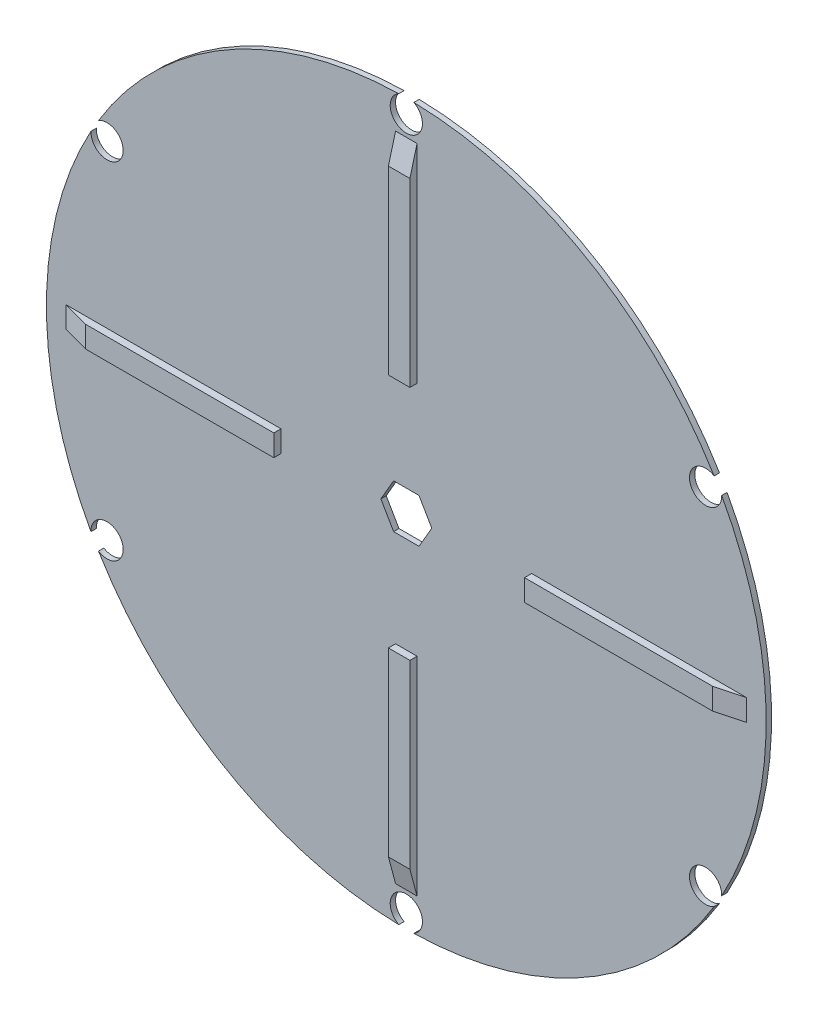
from build123d import *
from OCP.BRepFilletAPI import BRepFilletAPI_MakeChamfer

# Parameters (mm, degrees)
SKETCH1_R           = 100.5
BOSS_EXTRUDE1_DEPTH = 1.5
SKETCH8_W           = 1.221153846
SKETCH8_H           = 0.325641026
CUT_EXTRUDE6_DEPTH  = 0.2
CUT_EXTRUDE7_DEPTH  = 10
BOSS_EXTRUDE2_DEPTH = 2
CHAMFER1_SIZE       = 2
CHAMFER1_SIZE_2     = 7.464101615
SKETCH12_R          = 4.5
CUT_EXTRUDE8_DEPTH  = 10


with BuildPart() as part:
    # Sketch1 → Boss-Extrude1 (new body)
    with BuildSketch(Plane.XY):
        Circle(SKETCH1_R)
    extrude(amount=BOSS_EXTRUDE1_DEPTH)

    # Sketch8 → Cut-Extrude6 (cut)
    # profile 1 of 12: a face of its own
    with BuildSketch(Plane(origin=(0, 0, 0), x_dir=(-1, 0, 0), z_dir=(0, 0, -1))):
        with BuildLine():
            add(Edge.make_bspline(
                [(-21.303796635, -42.5044388), (-21.303499075, -42.453550456), (-21.302921062, -42.354699113), (-21.296490852, -42.210658759), (-21.285808934, -42.075530497), (-21.271170032, -41.949307858), (-21.253355578, -41.831958258), (-21.229574387, -41.723795299), (-21.202529916, -41.62431837), (-21.171185911, -41.533203084), (-21.135818417, -41.449221882), (-21.09732448, -41.370821878), (-21.054176417, -41.298121696), (-21.008840217, -41.229960986), (-20.959480695, -41.167455492), (-20.907502507, -41.109722505), (-20.850876948, -41.058096324), (-20.791528933, -41.011064321), (-20.72892114, -40.969835158), (-20.66483815, -40.933519745), (-20.598838876, -40.902495579), (-20.530743124, -40.878102113), (-20.461162947, -40.857953702), (-20.389855107, -40.844175156), (-20.31670187, -40.835505675), (-20.267324783, -40.834676848), (-20.242283213, -40.834256508)],
                knots=[0, 0, 0, 0, 1.646270934, 3.197905019, 4.663502075, 6.030701355, 7.308322542, 8.50163776, 9.611534131, 10.641858119, 11.616356847, 12.558055219, 13.465016945, 14.349605745, 15.204443733, 16.039544428, 16.859896111, 17.680448484, 18.487036065, 19.28249412, 20.06191084, 20.843045899, 21.620316918, 22.403196591, 23.190181807, 24, 24, 24, 24], degree=3))
            add(Edge.make_bspline(
                [(-20.242283213, -40.834256508), (-20.217032458, -40.834699027), (-20.16681665, -40.835579056), (-20.092575738, -40.844037204), (-20.020049955, -40.858071722), (-19.949548501, -40.877957178), (-19.880492263, -40.902627542), (-19.813421379, -40.933549427), (-19.747919241, -40.969543828), (-19.685026766, -41.011838345), (-19.624053507, -41.058993695), (-19.566497141, -41.112299831), (-19.512352427, -41.171218505), (-19.460939829, -41.235119338), (-19.413717966, -41.305227951), (-19.368747781, -41.380324965), (-19.328496005, -41.461723678), (-19.28972955, -41.548065959), (-19.256267783, -41.64174085), (-19.226090547, -41.742220311), (-19.201707482, -41.850691181), (-19.181397214, -41.966584346), (-19.165662915, -42.09032542), (-19.154203304, -42.221649149), (-19.148149863, -42.360641932), (-19.147009855, -42.455672267), (-19.14642484, -42.5044388)],
                knots=[0, 0, 0, 0, 0.810914788, 1.612654377, 2.396697861, 3.181598691, 3.963628158, 4.749916497, 5.551656086, 6.361998678, 7.18212741, 8.025565596, 8.878627764, 9.750805457, 10.657531673, 11.591944965, 12.560506719, 13.57287815, 14.630710178, 15.753379473, 16.941251878, 18.199788006, 19.531962791, 20.947069417, 22.433333509, 24, 24, 24, 24], degree=3))
            add(Edge.make_bspline(
                [(-19.14642484, -42.5044388), (-19.14701592, -42.552992631), (-19.148167616, -42.64759779), (-19.154135443, -42.785965175), (-19.165890773, -42.916591971), (-19.180595548, -43.039791462), (-19.200961778, -43.155050874), (-19.226003608, -43.262769052), (-19.253807829, -43.363411174), (-19.288129392, -43.456152753), (-19.325694822, -43.54228753), (-19.366566322, -43.622721301), (-19.41035395, -43.698165009), (-19.458059454, -43.768014779), (-19.508907908, -43.832765418), (-19.563987616, -43.891273976), (-19.621745933, -43.944950228), (-19.682898624, -43.992712776), (-19.74677196, -44.034518277), (-19.812049122, -44.071905127), (-19.879888334, -44.102051929), (-19.948752227, -44.127937288), (-20.019625817, -44.147713412), (-20.092420757, -44.161387553), (-20.166766771, -44.170977729), (-20.217023905, -44.171709322), (-20.242283213, -44.172077021)],
                knots=[0, 0, 0, 0, 1.561518951, 3.042555995, 4.452378317, 5.7783523, 7.031515105, 8.214008947, 9.334062868, 10.386615937, 11.391082383, 12.354592575, 13.286541444, 14.194233754, 15.072674879, 15.931287219, 16.775624067, 17.606195743, 18.42308326, 19.229000347, 20.022332153, 20.807536673, 21.593273796, 22.3848459, 23.188221202, 24, 24, 24, 24], degree=3))
            add(Edge.make_bspline(
                [(-20.242283213, -44.172077021), (-20.267324088, -44.17165397), (-20.316699806, -44.170819796), (-20.389863077, -44.162189483), (-20.460876437, -44.148314276), (-20.530090306, -44.128886357), (-20.597859788, -44.105105755), (-20.663261419, -44.074123485), (-20.72702239, -44.038441865), (-20.788972587, -43.997806019), (-20.847947904, -43.951249921), (-20.904280211, -43.899756602), (-20.956554335, -43.842041078), (-21.005208122, -43.779014677), (-21.051448902, -43.711257236), (-21.093984262, -43.63784364), (-21.133327822, -43.559064986), (-21.169290132, -43.47441231), (-21.201174991, -43.38265034), (-21.229339697, -43.282729299), (-21.25157754, -43.173767258), (-21.270612078, -43.056639361), (-21.285964912, -42.930842295), (-21.296446335, -42.796307768), (-21.302924528, -42.653119614), (-21.303500628, -42.554903462), (-21.303796635, -42.5044388)],
                knots=[0, 0, 0, 0, 0.810891512, 1.598919785, 2.382837074, 3.152667961, 3.926044502, 4.706494248, 5.493654104, 6.291793342, 7.103789334, 7.925228297, 8.761435821, 9.622817696, 10.50288917, 11.416980706, 12.369136599, 13.353924996, 14.394355917, 15.514179734, 16.714354668, 17.994756427, 19.357759367, 20.818452758, 22.365282078, 24, 24, 24, 24], degree=3))
        make_face()
        with BuildLine():
            add(Edge.make_bspline(
                [(-21.018860737, -42.503166765), (-21.018752382, -42.545574513), (-21.018542085, -42.627879625), (-21.013048246, -42.747480298), (-21.005564107, -42.859031953), (-20.99591093, -42.962676233), (-20.981575398, -43.058062315), (-20.965512812, -43.145846242), (-20.945965617, -43.22556345), (-20.922837993, -43.297760964), (-20.896495384, -43.363664048), (-20.867733636, -43.424988007), (-20.836835695, -43.482457264), (-20.802256179, -43.535555608), (-20.764596086, -43.5844562), (-20.724706058, -43.630024555), (-20.681097357, -43.670661817), (-20.620768962, -43.71939975), (-20.541125017, -43.769763535), (-20.440776462, -43.813620345), (-20.337662938, -43.841181574), (-20.267675733, -43.844686552), (-20.232742949, -43.846435996)],
                knots=[0, 0, 0, 0, 1.459021318, 2.831673884, 4.118529203, 5.306027144, 6.411944654, 7.436330062, 8.375795394, 9.233974572, 10.042671642, 10.816086306, 11.563610507, 12.285937304, 12.993564865, 13.685989202, 14.367179055, 15.041617293, 16.353048772, 17.594441528, 18.799311195, 20, 20, 20, 20], degree=3))
            add(Edge.make_bspline(
                [(-20.232742949, -43.846435996), (-20.197584204, -43.84498658), (-20.127339304, -43.842090742), (-20.024710789, -43.814151887), (-19.925079044, -43.771997376), (-19.846999499, -43.722152139), (-19.787597477, -43.674682869), (-19.745037065, -43.63421101), (-19.705973635, -43.588893901), (-19.668924038, -43.53999954), (-19.634943305, -43.486593787), (-19.604043173, -43.42893345), (-19.575846137, -43.36685841), (-19.559781502, -43.323524433), (-19.551568069, -43.301368888)],
                knots=[0, 0, 0, 0, 1.353760809, 2.704726607, 4.075137775, 5.516104923, 6.260822281, 7.007110065, 7.778089737, 8.566572457, 9.372053459, 10.217411131, 11.088608312, 12, 12, 12, 12], degree=3))
            add(Edge.make_bspline(
                [(-19.551568069, -43.301368888), (-19.541996108, -43.273039053), (-19.522560923, -43.215517338), (-19.497513099, -43.126287454), (-19.477786916, -43.032667804), (-19.460040148, -42.935217877), (-19.447927019, -42.833219005), (-19.438177217, -42.726986785), (-19.432434379, -42.616441121), (-19.431722498, -42.541334236), (-19.431360737, -42.503166765)],
                knots=[0, 0, 0, 0, 0.884706709, 1.796334032, 2.740027952, 3.714592787, 4.726048262, 5.777819803, 6.87074269, 8, 8, 8, 8], degree=3))
            add(Edge.make_bspline(
                [(-19.431360737, -42.503166765), (-19.431859838, -42.465005467), (-19.432836184, -42.39035381), (-19.436568159, -42.281026604), (-19.446205259, -42.177187992), (-19.456908745, -42.078390635), (-19.47269051, -41.985181431), (-19.48970652, -41.896780083), (-19.51256762, -41.814281768), (-19.536987702, -41.736394861), (-19.564937132, -41.664004268), (-19.595703548, -41.596772476), (-19.628561858, -41.534374904), (-19.66425089, -41.47698275), (-19.702346974, -41.424338943), (-19.743855608, -41.377498989), (-19.787130289, -41.335011168), (-19.847743022, -41.286512981), (-19.927094699, -41.237063086), (-20.025833251, -41.191555575), (-20.128585906, -41.165422338), (-20.198048968, -41.161737808), (-20.232742949, -41.159897534)],
                knots=[0, 0, 0, 0, 1.31362396, 2.569729283, 3.763502607, 4.902122613, 5.988968491, 7.01645872, 7.998833611, 8.933434873, 9.825090667, 10.667526885, 11.477055099, 12.250526234, 12.991942729, 13.710640831, 14.402115721, 15.076753259, 16.378508321, 17.609869233, 18.806226677, 20, 20, 20, 20], degree=3))
            add(Edge.make_bspline(
                [(-20.232742949, -41.159897534), (-20.267858986, -41.161740346), (-20.338155033, -41.165429328), (-20.441975678, -41.191458208), (-20.541493197, -41.236827113), (-20.620635038, -41.286676765), (-20.681290045, -41.334155091), (-20.724000774, -41.375327088), (-20.764047658, -41.420363333), (-20.800939072, -41.469713642), (-20.835491493, -41.522750082), (-20.867224269, -41.57988989), (-20.895814989, -41.641422628), (-20.922198819, -41.707296108), (-20.945396991, -41.779487394), (-20.964532229, -41.859106409), (-20.98220977, -41.946611125), (-20.994724049, -42.042513822), (-21.005849028, -42.146184061), (-21.012998536, -42.2580142), (-21.018560463, -42.377815459), (-21.018758641, -42.460546124), (-21.018860737, -42.503166765)],
                knots=[0, 0, 0, 0, 1.207732386, 2.417664972, 3.655092373, 4.956220595, 5.625982001, 6.301752483, 6.994047911, 7.697131622, 8.419323945, 9.170223765, 9.943494443, 10.752040957, 11.610060368, 12.549350801, 13.567764191, 14.679664412, 15.874934091, 17.154273443, 18.533957287, 20, 20, 20, 20], degree=3))
        make_face(mode=Mode.SUBTRACT)
    # profile 2 of 12: a face of its own
    with BuildSketch(Plane(origin=(0, 0, 0), x_dir=(-1, 0, 0), z_dir=(0, 0, -1))):
        with BuildLine():
            Line((-18.45443766, -41.892589842), (-18.739373558, -41.892589842))
            add(Edge.make_bspline(
                [(-18.739373558, -41.892589842), (-18.737516498, -41.854788394), (-18.733869281, -41.780547355), (-18.716789333, -41.672303526), (-18.692350108, -41.56883953), (-18.657795718, -41.470986108), (-18.614882166, -41.377878047), (-18.563419927, -41.289885176), (-18.502465505, -41.207343169), (-18.433335111, -41.131017218), (-18.358252131, -41.060997065), (-18.277238886, -41.000531237), (-18.19210804, -40.949443064), (-18.103117871, -40.906733652), (-18.00926436, -40.874675363), (-17.911399196, -40.85088859), (-17.809092408, -40.836577191), (-17.73938753, -40.835038871), (-17.703936859, -40.834256508)],
                knots=[0, 0, 0, 0, 1.10065271, 2.161652631, 3.183658789, 4.190468796, 5.17591951, 6.163126047, 7.15150782, 8.156236427, 9.156009102, 10.134482811, 11.092018607, 12.041330605, 13.001268258, 13.972401359, 14.968799086, 16, 16, 16, 16], degree=3))
            add(Edge.make_bspline(
                [(-17.703936859, -40.834256508), (-17.669122463, -40.835071537), (-17.600713419, -40.836673038), (-17.500871449, -40.850426258), (-17.405823475, -40.871966902), (-17.315755287, -40.902188744), (-17.231385499, -40.942814617), (-17.152080309, -40.99161667), (-17.076895574, -41.048058946), (-17.009216563, -41.114510619), (-16.947069948, -41.185451354), (-16.893455759, -41.261186809), (-16.84754239, -41.33940909), (-16.809272137, -41.420714673), (-16.781099783, -41.505869105), (-16.75971098, -41.593632639), (-16.747621111, -41.684913718), (-16.74576562, -41.746696093), (-16.744822276, -41.778106669)],
                knots=[0, 0, 0, 0, 1.111607364, 2.184268762, 3.212621178, 4.221274766, 5.211760367, 6.196651075, 7.1921475, 8.207485113, 9.220403448, 10.201281604, 11.166441695, 12.114753415, 13.065576456, 14.026450734, 14.996634279, 16, 16, 16, 16], degree=3))
            add(Edge.make_bspline(
                [(-16.744822276, -41.778106669), (-16.746358307, -41.822327919), (-16.749403415, -41.909994398), (-16.775451456, -42.038822167), (-16.816133648, -42.163639054), (-16.865116965, -42.264093606), (-16.914531253, -42.345041133), (-16.959060635, -42.411687744), (-17.011189428, -42.483447704), (-17.071676351, -42.560080718), (-17.139270171, -42.642187039), (-17.214583134, -42.729717067), (-17.298152292, -42.821766459), (-17.356806789, -42.88463654), (-17.38720008, -42.917214241)],
                knots=[0, 0, 0, 0, 1.184426356, 2.348067706, 3.509069118, 4.696110526, 5.333549288, 6.050745305, 6.844228056, 7.710549037, 8.667450064, 9.695053472, 10.805634456, 12, 12, 12, 12], degree=3))
            Line((-17.38720008, -42.917214241), (-18.181586098, -43.765025739))
            Line((-18.181586098, -43.765025739), (-16.704117148, -43.765025739))
            Line((-16.704117148, -43.765025739), (-16.704117148, -44.090666765))
            Line((-16.704117148, -44.090666765), (-18.861488943, -44.090666765))
            Line((-18.861488943, -44.090666765), (-17.630158814, -42.776654345))
            add(Edge.make_bspline(
                [(-17.630158814, -42.776654345), (-17.60017966, -42.745359453), (-17.54259584, -42.685248369), (-17.461150216, -42.597488684), (-17.387999134, -42.516073029), (-17.322669071, -42.441155231), (-17.266577248, -42.371639452), (-17.216800295, -42.309777114), (-17.176917223, -42.252849863), (-17.133632542, -42.186863734), (-17.091709859, -42.106298275), (-17.055685079, -42.007842714), (-17.033718752, -41.906490135), (-17.031083652, -41.837999001), (-17.029758173, -41.803547374)],
                knots=[0, 0, 0, 0, 1.329631726, 2.553950428, 3.673215718, 4.687767853, 5.603093632, 6.413772471, 7.123043292, 7.734684054, 8.834405432, 9.900288307, 10.943827018, 12, 12, 12, 12], degree=3))
            add(Edge.make_bspline(
                [(-17.029758173, -41.803547374), (-17.030334882, -41.781883534), (-17.031471465, -41.739188265), (-17.041502377, -41.676590184), (-17.056661193, -41.616206389), (-17.078382963, -41.557851141), (-17.107054791, -41.502111157), (-17.141955643, -41.448918586), (-17.182223772, -41.397493596), (-17.228806709, -41.349275961), (-17.279980016, -41.305115153), (-17.334040514, -41.265995447), (-17.391235966, -41.233302825), (-17.451325219, -41.206502653), (-17.514140752, -41.185479271), (-17.579804057, -41.170911846), (-17.6481337, -41.161765592), (-17.694791229, -41.160528093), (-17.718565265, -41.159897534)],
                knots=[0, 0, 0, 0, 0.991446411, 1.95395049, 2.89581595, 3.838931463, 4.798493298, 5.75982156, 6.748411868, 7.785213223, 8.824556874, 9.840280684, 10.836137867, 11.835679398, 12.848801643, 13.863922112, 14.911575587, 16, 16, 16, 16], degree=3))
            add(Edge.make_bspline(
                [(-17.718565265, -41.159897534), (-17.74339452, -41.160546171), (-17.792155078, -41.161819985), (-17.863745915, -41.170730545), (-17.93204087, -41.186102843), (-17.997211739, -41.207127398), (-18.059368792, -41.23385051), (-18.118209747, -41.267135164), (-18.17360251, -41.306853047), (-18.225651214, -41.351884123), (-18.273606395, -41.402019733), (-18.315740346, -41.457908771), (-18.352555845, -41.518530783), (-18.384677078, -41.583722197), (-18.410762597, -41.654074554), (-18.430695384, -41.729338115), (-18.446467737, -41.809186083), (-18.451736895, -41.864326838), (-18.45443766, -41.892589842)],
                knots=[0, 0, 0, 0, 1.031018746, 2.02475058, 2.990194455, 3.934040569, 4.864654155, 5.795059489, 6.735614925, 7.690564532, 8.649604399, 9.611025574, 10.590972636, 11.591080095, 12.624614302, 13.701020113, 14.821632451, 16, 16, 16, 16], degree=3))
        make_face()
    # profile 3 of 12: a face of its own
    with BuildSketch(Plane(origin=(0, 0, 0), x_dir=(-1, 0, 0), z_dir=(0, 0, -1))):
        with Locations((-15.808604327, -42.869512919)):
            Rectangle(SKETCH8_W, SKETCH8_H)
    # profile 4 of 12: a face of its own
    with BuildSketch(Plane(origin=(0, 0, 0), x_dir=(-1, 0, 0), z_dir=(0, 0, -1))):
        with BuildLine():
            add(Edge.make_bspline(
                [(-14.953796635, -42.5044388), (-14.953499075, -42.453550456), (-14.952921062, -42.354699113), (-14.946490852, -42.210658759), (-14.935808934, -42.075530497), (-14.921170032, -41.949307858), (-14.903355578, -41.831958258), (-14.879574387, -41.723795299), (-14.852529916, -41.62431837), (-14.821185911, -41.533203084), (-14.785818417, -41.449221882), (-14.74732448, -41.370821878), (-14.704176417, -41.298121696), (-14.658840217, -41.229960986), (-14.609480695, -41.167455492), (-14.557502507, -41.109722505), (-14.500876948, -41.058096324), (-14.441528933, -41.011064321), (-14.37892114, -40.969835158), (-14.31483815, -40.933519745), (-14.248838876, -40.902495579), (-14.180743124, -40.878102113), (-14.111162947, -40.857953702), (-14.039855107, -40.844175156), (-13.96670187, -40.835505675), (-13.917324783, -40.834676848), (-13.892283213, -40.834256508)],
                knots=[0, 0, 0, 0, 1.646270934, 3.197905019, 4.663502075, 6.030701355, 7.308322542, 8.50163776, 9.611534131, 10.641858119, 11.616356847, 12.558055219, 13.465016945, 14.349605745, 15.204443733, 16.039544428, 16.859896111, 17.680448484, 18.487036065, 19.28249412, 20.06191084, 20.843045899, 21.620316918, 22.403196591, 23.190181807, 24, 24, 24, 24], degree=3))
            add(Edge.make_bspline(
                [(-13.892283213, -40.834256508), (-13.867032458, -40.834699027), (-13.81681665, -40.835579056), (-13.742575738, -40.844037204), (-13.670049955, -40.858071722), (-13.599548501, -40.877957178), (-13.530492263, -40.902627542), (-13.463421379, -40.933549427), (-13.397919241, -40.969543828), (-13.335026766, -41.011838345), (-13.274053507, -41.058993695), (-13.216497141, -41.112299831), (-13.162352427, -41.171218505), (-13.110939829, -41.235119338), (-13.063717966, -41.305227951), (-13.018747781, -41.380324965), (-12.978496005, -41.461723678), (-12.93972955, -41.548065959), (-12.906267783, -41.64174085), (-12.876090547, -41.742220311), (-12.851707482, -41.850691181), (-12.831397214, -41.966584346), (-12.815662915, -42.09032542), (-12.804203304, -42.221649149), (-12.798149863, -42.360641932), (-12.797009855, -42.455672267), (-12.79642484, -42.5044388)],
                knots=[0, 0, 0, 0, 0.810914788, 1.612654377, 2.396697861, 3.181598691, 3.963628158, 4.749916497, 5.551656086, 6.361998678, 7.18212741, 8.025565596, 8.878627764, 9.750805457, 10.657531673, 11.591944965, 12.560506719, 13.57287815, 14.630710178, 15.753379473, 16.941251878, 18.199788006, 19.531962791, 20.947069417, 22.433333509, 24, 24, 24, 24], degree=3))
            add(Edge.make_bspline(
                [(-12.79642484, -42.5044388), (-12.79701592, -42.552992631), (-12.798167616, -42.64759779), (-12.804135443, -42.785965175), (-12.815890773, -42.916591971), (-12.830595548, -43.039791462), (-12.850961778, -43.155050874), (-12.876003608, -43.262769052), (-12.903807829, -43.363411174), (-12.938129392, -43.456152753), (-12.975694822, -43.54228753), (-13.016566322, -43.622721301), (-13.06035395, -43.698165009), (-13.108059454, -43.768014779), (-13.158907908, -43.832765418), (-13.213987616, -43.891273976), (-13.271745933, -43.944950228), (-13.332898624, -43.992712776), (-13.39677196, -44.034518277), (-13.462049122, -44.071905127), (-13.529888334, -44.102051929), (-13.598752227, -44.127937288), (-13.669625817, -44.147713412), (-13.742420757, -44.161387553), (-13.816766771, -44.170977729), (-13.867023905, -44.171709322), (-13.892283213, -44.172077021)],
                knots=[0, 0, 0, 0, 1.561518951, 3.042555995, 4.452378317, 5.7783523, 7.031515105, 8.214008947, 9.334062868, 10.386615937, 11.391082383, 12.354592575, 13.286541444, 14.194233754, 15.072674879, 15.931287219, 16.775624067, 17.606195743, 18.42308326, 19.229000347, 20.022332153, 20.807536673, 21.593273796, 22.3848459, 23.188221202, 24, 24, 24, 24], degree=3))
            add(Edge.make_bspline(
                [(-13.892283213, -44.172077021), (-13.917324088, -44.17165397), (-13.966699806, -44.170819796), (-14.039863077, -44.162189483), (-14.110876437, -44.148314276), (-14.180090306, -44.128886357), (-14.247859788, -44.105105755), (-14.313261419, -44.074123485), (-14.37702239, -44.038441865), (-14.438972587, -43.997806019), (-14.497947904, -43.951249921), (-14.554280211, -43.899756602), (-14.606554335, -43.842041078), (-14.655208122, -43.779014677), (-14.701448902, -43.711257236), (-14.743984262, -43.63784364), (-14.783327822, -43.559064986), (-14.819290132, -43.47441231), (-14.851174991, -43.38265034), (-14.879339697, -43.282729299), (-14.90157754, -43.173767258), (-14.920612078, -43.056639361), (-14.935964912, -42.930842295), (-14.946446335, -42.796307768), (-14.952924528, -42.653119614), (-14.953500628, -42.554903462), (-14.953796635, -42.5044388)],
                knots=[0, 0, 0, 0, 0.810891512, 1.598919785, 2.382837074, 3.152667961, 3.926044502, 4.706494248, 5.493654104, 6.291793342, 7.103789334, 7.925228297, 8.761435821, 9.622817696, 10.50288917, 11.416980706, 12.369136599, 13.353924996, 14.394355917, 15.514179734, 16.714354668, 17.994756427, 19.357759367, 20.818452758, 22.365282078, 24, 24, 24, 24], degree=3))
        make_face()
        with BuildLine():
            add(Edge.make_bspline(
                [(-14.668860737, -42.503166765), (-14.668752382, -42.545574513), (-14.668542085, -42.627879625), (-14.663048246, -42.747480298), (-14.655564107, -42.859031953), (-14.64591093, -42.962676233), (-14.631575398, -43.058062315), (-14.615512812, -43.145846242), (-14.595965617, -43.22556345), (-14.572837993, -43.297760964), (-14.546495384, -43.363664048), (-14.517733636, -43.424988007), (-14.486835695, -43.482457264), (-14.452256179, -43.535555608), (-14.414596086, -43.5844562), (-14.374706058, -43.630024555), (-14.331097357, -43.670661817), (-14.270768962, -43.71939975), (-14.191125017, -43.769763535), (-14.090776462, -43.813620345), (-13.987662938, -43.841181574), (-13.917675733, -43.844686552), (-13.882742949, -43.846435996)],
                knots=[0, 0, 0, 0, 1.459021318, 2.831673884, 4.118529203, 5.306027144, 6.411944654, 7.436330062, 8.375795394, 9.233974572, 10.042671642, 10.816086306, 11.563610507, 12.285937304, 12.993564865, 13.685989202, 14.367179055, 15.041617293, 16.353048772, 17.594441528, 18.799311195, 20, 20, 20, 20], degree=3))
            add(Edge.make_bspline(
                [(-13.882742949, -43.846435996), (-13.847584204, -43.84498658), (-13.777339304, -43.842090742), (-13.674710789, -43.814151887), (-13.575079044, -43.771997376), (-13.496999499, -43.722152139), (-13.437597477, -43.674682869), (-13.395037065, -43.63421101), (-13.355973635, -43.588893901), (-13.318924038, -43.53999954), (-13.284943305, -43.486593787), (-13.254043173, -43.42893345), (-13.225846137, -43.36685841), (-13.209781502, -43.323524433), (-13.201568069, -43.301368888)],
                knots=[0, 0, 0, 0, 1.353760809, 2.704726607, 4.075137775, 5.516104923, 6.260822281, 7.007110065, 7.778089737, 8.566572457, 9.372053459, 10.217411131, 11.088608312, 12, 12, 12, 12], degree=3))
            add(Edge.make_bspline(
                [(-13.201568069, -43.301368888), (-13.191996108, -43.273039053), (-13.172560923, -43.215517338), (-13.147513099, -43.126287454), (-13.127786916, -43.032667804), (-13.110040148, -42.935217877), (-13.097927019, -42.833219005), (-13.088177217, -42.726986785), (-13.082434379, -42.616441121), (-13.081722498, -42.541334236), (-13.081360737, -42.503166765)],
                knots=[0, 0, 0, 0, 0.884706709, 1.796334032, 2.740027952, 3.714592787, 4.726048262, 5.777819803, 6.87074269, 8, 8, 8, 8], degree=3))
            add(Edge.make_bspline(
                [(-13.081360737, -42.503166765), (-13.081859838, -42.465005467), (-13.082836184, -42.39035381), (-13.086568159, -42.281026604), (-13.096205259, -42.177187992), (-13.106908745, -42.078390635), (-13.12269051, -41.985181431), (-13.13970652, -41.896780083), (-13.16256762, -41.814281768), (-13.186987702, -41.736394861), (-13.214937132, -41.664004268), (-13.245703548, -41.596772476), (-13.278561858, -41.534374904), (-13.31425089, -41.47698275), (-13.352346974, -41.424338943), (-13.393855608, -41.377498989), (-13.437130289, -41.335011168), (-13.497743022, -41.286512981), (-13.577094699, -41.237063086), (-13.675833251, -41.191555575), (-13.778585906, -41.165422338), (-13.848048968, -41.161737808), (-13.882742949, -41.159897534)],
                knots=[0, 0, 0, 0, 1.31362396, 2.569729283, 3.763502607, 4.902122613, 5.988968491, 7.01645872, 7.998833611, 8.933434873, 9.825090667, 10.667526885, 11.477055099, 12.250526234, 12.991942729, 13.710640831, 14.402115721, 15.076753259, 16.378508321, 17.609869233, 18.806226677, 20, 20, 20, 20], degree=3))
            add(Edge.make_bspline(
                [(-13.882742949, -41.159897534), (-13.917858986, -41.161740346), (-13.988155033, -41.165429328), (-14.091975678, -41.191458208), (-14.191493197, -41.236827113), (-14.270635038, -41.286676765), (-14.331290045, -41.334155091), (-14.374000774, -41.375327088), (-14.414047658, -41.420363333), (-14.450939072, -41.469713642), (-14.485491493, -41.522750082), (-14.517224269, -41.57988989), (-14.545814989, -41.641422628), (-14.572198819, -41.707296108), (-14.595396991, -41.779487394), (-14.614532229, -41.859106409), (-14.63220977, -41.946611125), (-14.644724049, -42.042513822), (-14.655849028, -42.146184061), (-14.662998536, -42.2580142), (-14.668560463, -42.377815459), (-14.668758641, -42.460546124), (-14.668860737, -42.503166765)],
                knots=[0, 0, 0, 0, 1.207732386, 2.417664972, 3.655092373, 4.956220595, 5.625982001, 6.301752483, 6.994047911, 7.697131622, 8.419323945, 9.170223765, 9.943494443, 10.752040957, 11.610060368, 12.549350801, 13.567764191, 14.679664412, 15.874934091, 17.154273443, 18.533957287, 20, 20, 20, 20], degree=3))
        make_face(mode=Mode.SUBTRACT)
    # profile 5 of 12: a face of its own
    with BuildSketch(Plane(origin=(0, 0, 0), x_dir=(-1, 0, 0), z_dir=(0, 0, -1))):
        Polygon((-10.778340906, -40.834256508), (-10.720463301, -40.834256508), (-10.720463301, -43.032333432), (-10.354117148, -43.032333432), (-10.354117148, -43.357974457), (-10.720463301, -43.357974457), (-10.720463301, -44.090666765), (-11.005399199, -44.090666765), (-11.005399199, -43.357974457), (-12.511488943, -43.357974457), align=None)
        Polygon((-11.005399199, -43.032333432), (-11.005399199, -41.653447214), (-11.95179343, -43.032333432), align=None, mode=Mode.SUBTRACT)
    # profile 6 of 12: a face of its own
    with BuildSketch(Plane(origin=(0, 0, 0), x_dir=(-1, 0, 0), z_dir=(0, 0, -1))):
        with Locations((-9.458604327, -42.869512919)):
            Rectangle(SKETCH8_W, SKETCH8_H)
    # profile 7 of 12: a face of its own
    with BuildSketch(Plane(origin=(0, 0, 0), x_dir=(-1, 0, 0), z_dir=(0, 0, -1))):
        Polygon((-7.928981931, -40.915666765), (-7.34193766, -40.915666765), (-7.34193766, -44.090666765), (-7.626873558, -44.090666765), (-7.626873558, -41.241307791), (-8.115335096, -41.241307791), align=None)
    # profile 8 of 12: a face of its own
    with BuildSketch(Plane(origin=(0, 0, 0), x_dir=(-1, 0, 0), z_dir=(0, 0, -1))):
        Polygon((-4.428340906, -40.834256508), (-4.370463301, -40.834256508), (-4.370463301, -43.032333432), (-4.004117148, -43.032333432), (-4.004117148, -43.357974457), (-4.370463301, -43.357974457), (-4.370463301, -44.090666765), (-4.655399199, -44.090666765), (-4.655399199, -43.357974457), (-6.161488943, -43.357974457), align=None)
        Polygon((-4.655399199, -43.032333432), (-4.655399199, -41.653447214), (-5.60179343, -43.032333432), align=None, mode=Mode.SUBTRACT)
    # profile 9 of 12: a face of its own
    with BuildSketch(Plane(origin=(0, 0, 0), x_dir=(-1, 0, 0), z_dir=(0, 0, -1))):
        Polygon((-3.044366547, -40.915666765), (-2.457322276, -40.915666765), (-2.457322276, -44.090666765), (-2.742258173, -44.090666765), (-2.742258173, -41.241307791), (-3.230719712, -41.241307791), align=None)
    # profile 10 of 12: a face of its own
    with BuildSketch(Plane(origin=(0, 0, 0), x_dir=(-1, 0, 0), z_dir=(0, 0, -1))):
        Polygon((-0.602058854, -40.915666765), (-0.015014584, -40.915666765), (-0.015014584, -44.090666765), (-0.299950481, -44.090666765), (-0.299950481, -41.241307791), (-0.788412019, -41.241307791), align=None)
    # profile 11 of 12: a face of its own
    with BuildSketch(Plane(origin=(0, 0, 0), x_dir=(-1, 0, 0), z_dir=(0, 0, -1))):
        Polygon((1.840248838, -40.915666765), (2.427293109, -40.915666765), (2.427293109, -44.090666765), (2.142357211, -44.090666765), (2.142357211, -41.241307791), (1.653895673, -41.241307791), align=None)
    # profile 12 of 12: a face of its own
    with BuildSketch(Plane(origin=(0, 0, 0), x_dir=(-1, 0, 0), z_dir=(0, 0, -1))):
        with BuildLine():
            add(Edge.make_bspline(
                [(5.15135661, -42.321901741), (5.177344935, -42.335452601), (5.228030848, -42.361881304), (5.300218744, -42.404436126), (5.36619071, -42.449286144), (5.427777148, -42.494312959), (5.483896045, -42.541240957), (5.533919905, -42.590256749), (5.579084389, -42.640136857), (5.618478685, -42.691725926), (5.653128673, -42.7448869), (5.683075396, -42.799759312), (5.70867243, -42.856222908), (5.72895881, -42.914894032), (5.745670007, -42.974910841), (5.757168591, -43.037048296), (5.763352509, -43.100896948), (5.764521647, -43.144048193), (5.765113622, -43.165897133)],
                knots=[0, 0, 0, 0, 1.272397273, 2.481599622, 3.635517121, 4.734568067, 5.792894095, 6.808321871, 7.773003508, 8.711915296, 9.623354172, 10.525449501, 11.423591555, 12.311487226, 13.218079475, 14.126165749, 15.051214107, 16, 16, 16, 16], degree=3))
            add(Edge.make_bspline(
                [(5.765113622, -43.165897133), (5.764413833, -43.196465791), (5.763028689, -43.256972634), (5.750963703, -43.346277321), (5.732899787, -43.433010866), (5.706520515, -43.517154254), (5.672309082, -43.598243185), (5.630147952, -43.676347073), (5.582422073, -43.752746017), (5.544093256, -43.799753618), (5.524698958, -43.823539361)],
                knots=[0, 0, 0, 0, 1.025265484, 2.029385089, 3.018602448, 3.995076438, 4.983346944, 5.966715145, 6.97116228, 8, 8, 8, 8], degree=3))
            add(Edge.make_bspline(
                [(5.524698958, -43.823539361), (5.499447299, -43.851292285), (5.449256023, -43.906455182), (5.363274368, -43.978074845), (5.268911659, -44.038263224), (5.166533028, -44.087314157), (5.056412144, -44.125492043), (4.938572468, -44.152926327), (4.812784272, -44.168640245), (4.726328595, -44.170911722), (4.681975601, -44.172077021)],
                knots=[0, 0, 0, 0, 0.954267603, 1.896743057, 2.838368354, 3.796610408, 4.779680527, 5.799409237, 6.871065594, 8, 8, 8, 8], degree=3))
            add(Edge.make_bspline(
                [(4.681975601, -44.172077021), (4.639327741, -44.171031559), (4.556339338, -44.168997196), (4.435546121, -44.155213676), (4.322948764, -44.131058397), (4.217892579, -44.09799793), (4.121010907, -44.05499008), (4.032579808, -44.001461023), (3.951323419, -43.939565358), (3.879707689, -43.867525444), (3.816127458, -43.790365803), (3.760276439, -43.710762557), (3.713854239, -43.62870844), (3.674550374, -43.545426949), (3.644462239, -43.459750795), (3.623623162, -43.372120783), (3.61038857, -43.282689975), (3.608627684, -43.222336261), (3.607741827, -43.191973856)],
                knots=[0, 0, 0, 0, 1.256902934, 2.445805442, 3.576955095, 4.645999104, 5.686449165, 6.692658513, 7.68621702, 8.689161843, 9.678783111, 10.630372946, 11.551080876, 12.453998257, 13.34127905, 14.221779781, 15.105423033, 16, 16, 16, 16], degree=3))
            add(Edge.make_bspline(
                [(3.607741827, -43.191973856), (3.608266047, -43.169695161), (3.609302092, -43.125664595), (3.616472919, -43.06061399), (3.628001309, -42.997298924), (3.643658102, -42.935485536), (3.664877104, -42.875623838), (3.690496754, -42.817430194), (3.720370739, -42.760838905), (3.754915796, -42.705540491), (3.795104061, -42.652309791), (3.840609657, -42.600243424), (3.892342081, -42.550149302), (3.949725814, -42.501415388), (4.012105075, -42.453177183), (4.081100121, -42.408041629), (4.154881921, -42.362813333), (4.207319682, -42.335772923), (4.234219191, -42.321901741)],
                knots=[0, 0, 0, 0, 0.941657376, 1.861047343, 2.762797495, 3.66048619, 4.553285746, 5.444104102, 6.34607688, 7.256116206, 8.197091036, 9.162375105, 10.176350973, 11.237807142, 12.343728897, 13.50695164, 14.721116704, 16, 16, 16, 16], degree=3))
            add(Edge.make_bspline(
                [(4.234219191, -42.321901741), (4.197397015, -42.301822344), (4.126098976, -42.26294301), (4.031693126, -42.191508408), (3.950603061, -42.114140176), (3.88505771, -42.029204576), (3.833466474, -41.939354912), (3.798071026, -41.84515334), (3.774125644, -41.74834658), (3.771753622, -41.682210244), (3.77056234, -41.64899509)],
                knots=[0, 0, 0, 0, 1.166880483, 2.259407225, 3.286803203, 4.280235371, 5.237608625, 6.161067461, 7.076446754, 8, 8, 8, 8], degree=3))
            add(Edge.make_bspline(
                [(3.77056234, -41.64899509), (3.772045903, -41.615160877), (3.775028124, -41.547148206), (3.799142993, -41.445905509), (3.838440482, -41.346467625), (3.891890244, -41.249316514), (3.958462933, -41.157740248), (4.038333728, -41.075606675), (4.12959529, -41.00365983), (4.231792069, -40.943265731), (4.341770654, -40.894113412), (4.45780849, -40.860205842), (4.577883809, -40.838038794), (4.659615311, -40.835529043), (4.70105613, -40.834256508)],
                knots=[0, 0, 0, 0, 0.888701115, 1.786444228, 2.72001202, 3.692817113, 4.693886446, 5.687152267, 6.695133018, 7.739871481, 8.800368666, 9.853104506, 10.91144658, 12, 12, 12, 12], degree=3))
            add(Edge.make_bspline(
                [(4.70105613, -40.834256508), (4.741427447, -40.835568548), (4.821035087, -40.838155741), (4.938051642, -40.859733838), (5.050015638, -40.895774188), (5.156540969, -40.944666669), (5.255720592, -41.004889108), (5.343352687, -41.077824187), (5.420761529, -41.159595451), (5.484791658, -41.251143948), (5.537553708, -41.347921752), (5.574293811, -41.449179325), (5.597835959, -41.552728828), (5.600805368, -41.622794732), (5.602293109, -41.657899337)],
                knots=[0, 0, 0, 0, 1.072916533, 2.115669174, 3.151510826, 4.193348718, 5.225979165, 6.227137561, 7.216255879, 8.211077061, 9.189680878, 10.138522389, 11.067357538, 12, 12, 12, 12], degree=3))
            add(Edge.make_bspline(
                [(5.602293109, -41.657899337), (5.600991757, -41.692349596), (5.598435977, -41.760007948), (5.576936746, -41.858638434), (5.540729669, -41.951005569), (5.491295678, -42.038157462), (5.426865415, -42.118513535), (5.348298921, -42.193095618), (5.25622258, -42.262516384), (5.187043062, -42.301692586), (5.15135661, -42.321901741)],
                knots=[0, 0, 0, 0, 0.975232327, 1.915300861, 2.843280834, 3.77672583, 4.742871857, 5.749627742, 6.839139064, 8, 8, 8, 8], degree=3))
        make_face()
        with BuildLine():
            add(Edge.make_bspline(
                [(4.685155689, -41.159897534), (4.662884601, -41.160488484), (4.619312614, -41.16164464), (4.555423748, -41.167684975), (4.494670244, -41.179435393), (4.436417339, -41.195073367), (4.381463702, -41.216198899), (4.329062999, -41.241050086), (4.280107048, -41.271263445), (4.234004866, -41.305155389), (4.192502378, -41.342432525), (4.155668249, -41.381270685), (4.125072031, -41.422432647), (4.099090453, -41.464894516), (4.080238648, -41.509916539), (4.066119601, -41.556118392), (4.056575196, -41.604083919), (4.055860013, -41.636864897), (4.055498237, -41.653447214)],
                knots=[0, 0, 0, 0, 1.203892937, 2.355340988, 3.463153438, 4.544400666, 5.610487187, 6.640501085, 7.674077295, 8.714426146, 9.728707835, 10.68524104, 11.601827946, 12.495867327, 13.368432065, 14.231010473, 15.105153427, 16, 16, 16, 16], degree=3))
            add(Edge.make_bspline(
                [(4.055498237, -41.653447214), (4.056121777, -41.670030247), (4.057353982, -41.702800704), (4.066883633, -41.751193025), (4.081086637, -41.798746939), (4.103448309, -41.844331694), (4.13026922, -41.889528598), (4.163372201, -41.933208058), (4.202822962, -41.975522086), (4.247297855, -42.016110779), (4.29574975, -42.054118943), (4.34707956, -42.087114614), (4.400643073, -42.1147227), (4.45588995, -42.137700089), (4.513383256, -42.155561675), (4.572770699, -42.168233233), (4.634062262, -42.176109044), (4.675591789, -42.177049771), (4.696604006, -42.177525739)],
                knots=[0, 0, 0, 0, 0.873023192, 1.725219244, 2.590779336, 3.480155217, 4.391973325, 5.357036234, 6.360879153, 7.436073238, 8.526419356, 9.601555421, 10.645666583, 11.697338044, 12.750135903, 13.812665442, 14.89329948, 16, 16, 16, 16], degree=3))
            add(Edge.make_bspline(
                [(4.696604006, -42.177525739), (4.7235916, -42.176733924), (4.777300234, -42.175158114), (4.856475056, -42.160506692), (4.933457598, -42.137459896), (5.007425033, -42.105927641), (5.076462763, -42.066350939), (5.138003397, -42.01896813), (5.191522007, -41.964873299), (5.236462417, -41.904908584), (5.271305635, -41.841089643), (5.298430847, -41.777045091), (5.314270663, -41.712091639), (5.316336742, -41.66857875), (5.317357211, -41.647087037)],
                knots=[0, 0, 0, 0, 1.076279235, 2.141928126, 3.20205304, 4.278698113, 5.344010996, 6.36967002, 7.368914609, 8.37248503, 9.349703398, 10.264243087, 11.142681841, 12, 12, 12, 12], degree=3))
            add(Edge.make_bspline(
                [(5.317357211, -41.647087037), (5.316874704, -41.632003033), (5.315916997, -41.602063447), (5.308024803, -41.557850787), (5.294983869, -41.514643951), (5.277328075, -41.472086005), (5.254096333, -41.430774056), (5.226551677, -41.390058683), (5.193092165, -41.350855811), (5.155539686, -41.31225185), (5.112953494, -41.276524914), (5.065415659, -41.245106284), (5.0131699, -41.218425075), (4.956214981, -41.196754561), (4.894760657, -41.180478287), (4.829089978, -41.1682896), (4.758655372, -41.161419706), (4.710186955, -41.160415929), (4.685155689, -41.159897534)],
                knots=[0, 0, 0, 0, 0.814439003, 1.616544685, 2.417341072, 3.248991801, 4.09997495, 4.973547432, 5.9003056, 6.880240646, 7.880314356, 8.896779544, 9.951930927, 11.043077905, 12.18215768, 13.381699519, 14.647792085, 16, 16, 16, 16], degree=3))
        make_face(mode=Mode.SUBTRACT)
        with BuildLine():
            add(Edge.make_bspline(
                [(4.7036002, -42.503166765), (4.675364666, -42.503668997), (4.619973438, -42.504654253), (4.538823224, -42.515621157), (4.460942139, -42.530887821), (4.386592768, -42.554047938), (4.315806508, -42.584161897), (4.248200161, -42.62038823), (4.184290922, -42.663210311), (4.124961306, -42.712084098), (4.070783714, -42.764752317), (4.02325097, -42.820507253), (3.982885363, -42.878312694), (3.950379485, -42.938902788), (3.923698842, -43.000994549), (3.906178397, -43.066134296), (3.894946415, -43.133069749), (3.893438171, -43.178572124), (3.892677724, -43.201514121)],
                knots=[0, 0, 0, 0, 1.140299081, 2.23698856, 3.303958914, 4.344563908, 5.37730929, 6.408454204, 7.439741482, 8.480804886, 9.510774543, 10.48932336, 11.43758569, 12.353841022, 13.263987381, 14.161954604, 15.073269652, 16, 16, 16, 16], degree=3))
            add(Edge.make_bspline(
                [(3.892677724, -43.201514121), (3.893914395, -43.230026443), (3.89636792, -43.286594223), (3.915832157, -43.370199295), (3.947070107, -43.451135538), (3.990635838, -43.528743381), (4.044581422, -43.601269548), (4.110917575, -43.664487223), (4.185521764, -43.72065885), (4.270918245, -43.766089049), (4.364198354, -43.802370096), (4.465337279, -43.82736729), (4.572883527, -43.843914891), (4.647141871, -43.845582384), (4.685155689, -43.846435996)],
                knots=[0, 0, 0, 0, 0.898778495, 1.783155532, 2.693654817, 3.627872908, 4.583023416, 5.533784346, 6.509005473, 7.520592997, 8.575161974, 9.658835044, 10.801527049, 12, 12, 12, 12], degree=3))
            add(Edge.make_bspline(
                [(4.685155689, -43.846435996), (4.714864951, -43.845865577), (4.772748121, -43.844754217), (4.857190375, -43.834944108), (4.93687793, -43.819386948), (5.011656254, -43.796759589), (5.082362452, -43.76913711), (5.147797708, -43.733602436), (5.209645372, -43.693187114), (5.264857827, -43.645237215), (5.315143666, -43.594002245), (5.358988867, -43.539764134), (5.39705036, -43.483996954), (5.426923441, -43.425440443), (5.450805114, -43.365218027), (5.467971482, -43.302774385), (5.478563477, -43.237917995), (5.479634718, -43.193922409), (5.480177724, -43.171621292)],
                knots=[0, 0, 0, 0, 1.224942928, 2.386581632, 3.501229538, 4.569074225, 5.605009692, 6.626002462, 7.634866581, 8.645888296, 9.63523824, 10.59253846, 11.518950513, 12.414518923, 13.29783783, 14.186679152, 15.080837789, 16, 16, 16, 16], degree=3))
            add(Edge.make_bspline(
                [(5.480177724, -43.171621292), (5.47935599, -43.149961133), (5.477735674, -43.107251083), (5.467451676, -43.043962877), (5.44938513, -42.982818896), (5.424595277, -42.923083533), (5.391592547, -42.865967142), (5.352726129, -42.809981758), (5.305832178, -42.756681269), (5.252843609, -42.705651675), (5.195095837, -42.658465971), (5.13371207, -42.616724301), (5.069164808, -42.581570596), (5.001590638, -42.552980632), (4.931139606, -42.530494856), (4.857863528, -42.514786775), (4.781676614, -42.504899278), (4.729919695, -42.503750794), (4.7036002, -42.503166765)],
                knots=[0, 0, 0, 0, 0.917430815, 1.809013306, 2.70690318, 3.612392954, 4.541220862, 5.495268465, 6.494511384, 7.542276156, 8.608045339, 9.649016899, 10.681629292, 11.715607085, 12.752076957, 13.808767841, 14.885711793, 16, 16, 16, 16], degree=3))
        make_face(mode=Mode.SUBTRACT)
    extrude(amount=-CUT_EXTRUDE6_DEPTH, mode=Mode.SUBTRACT)

    # Sketch9 → Cut-Extrude7 (cut)
    with BuildSketch(Plane.XY.offset(1.5)):
        Polygon((-7.101408311, 0), (-3.550704156, -6.15), (3.550704156, -6.15), (7.101408311, 0), (3.550704156, 6.15), (-3.550704156, 6.15), align=None)
    extrude(amount=-CUT_EXTRUDE7_DEPTH, mode=Mode.SUBTRACT)

    # Sketch11 → Boss-Extrude2 (add)
    with BuildSketch(Plane.XY.offset(1.5)):
        Polygon((-95, 0), (-95, 3), (-35, 3), (-35, -3), (-95, -3), align=None)
        Polygon((0, 91), (-3, 91), (-3, 33), (3, 33), (3, 91), align=None)
        Polygon((35, 3), (95, 3), (95, 0), (95, -3), (35, -3), align=None)
        Polygon((3, -33), (-3, -33), (-3, -91), (0, -91), (3, -91), align=None)
    extrude(amount=BOSS_EXTRUDE2_DEPTH)

    # Chamfer1
    chamfer1_edges_1 = [part.edges().sort_by_distance(p)[0] for p in [
        (95, 0, 3.5),
    ]]
    chamfer1_side_1 = [part.faces().sort_by_distance(p)[0] for p in [
        (95, 0, 3.46),
    ]]
    chamfer1_edges_2 = [part.edges().sort_by_distance(p)[0] for p in [
        (0, 91, 3.5),
    ]]
    chamfer1_side_2 = [part.faces().sort_by_distance(p)[0] for p in [
        (0, 91, 3.46),
    ]]
    chamfer1_edges_3 = [part.edges().sort_by_distance(p)[0] for p in [
        (0, -91, 3.5),
    ]]
    chamfer1_side_3 = [part.faces().sort_by_distance(p)[0] for p in [
        (0, -91, 3.46),
    ]]
    chamfer1_edges_4 = [part.edges().sort_by_distance(p)[0] for p in [
        (-95, 0, 3.5),
    ]]
    chamfer1_side_4 = [part.faces().sort_by_distance(p)[0] for p in [
        (-95, 0, 3.46),
    ]]
    chamfer1 = BRepFilletAPI_MakeChamfer(part.part.solid().wrapped)
    for e in chamfer1_edges_1:
        chamfer1.Add(CHAMFER1_SIZE - 0.0001, CHAMFER1_SIZE_2 - 0.0001, e.wrapped, chamfer1_side_1[0].wrapped)
    for e in chamfer1_edges_2:
        chamfer1.Add(CHAMFER1_SIZE - 0.0001, CHAMFER1_SIZE_2 - 0.0001, e.wrapped, chamfer1_side_2[0].wrapped)
    for e in chamfer1_edges_3:
        chamfer1.Add(CHAMFER1_SIZE - 0.0001, CHAMFER1_SIZE_2 - 0.0001, e.wrapped, chamfer1_side_3[0].wrapped)
    for e in chamfer1_edges_4:
        chamfer1.Add(CHAMFER1_SIZE - 0.0001, CHAMFER1_SIZE_2 - 0.0001, e.wrapped, chamfer1_side_4[0].wrapped)
    add(Compound.cast(chamfer1.Shape()), mode=Mode.REPLACE)  # a hair under: the kernel refuses the full size

    # Sketch12 → Cut-Extrude8 (cut)
    with BuildSketch(Plane.XY.offset(1.5)):
        with Locations((0, 96.5)):
            Circle(SKETCH12_R)
        with Locations((83.571451465, 48.25)):
            Circle(SKETCH12_R)
        with Locations((83.571451465, -48.25)):
            Circle(SKETCH12_R)
        with Locations((0, -96.5)):
            Circle(SKETCH12_R)
        with Locations((-83.571451465, -48.25)):
            Circle(SKETCH12_R)
        with Locations((-83.571451465, 48.25)):
            Circle(SKETCH12_R)
    extrude(amount=-CUT_EXTRUDE8_DEPTH, mode=Mode.SUBTRACT)


solid = part.part
